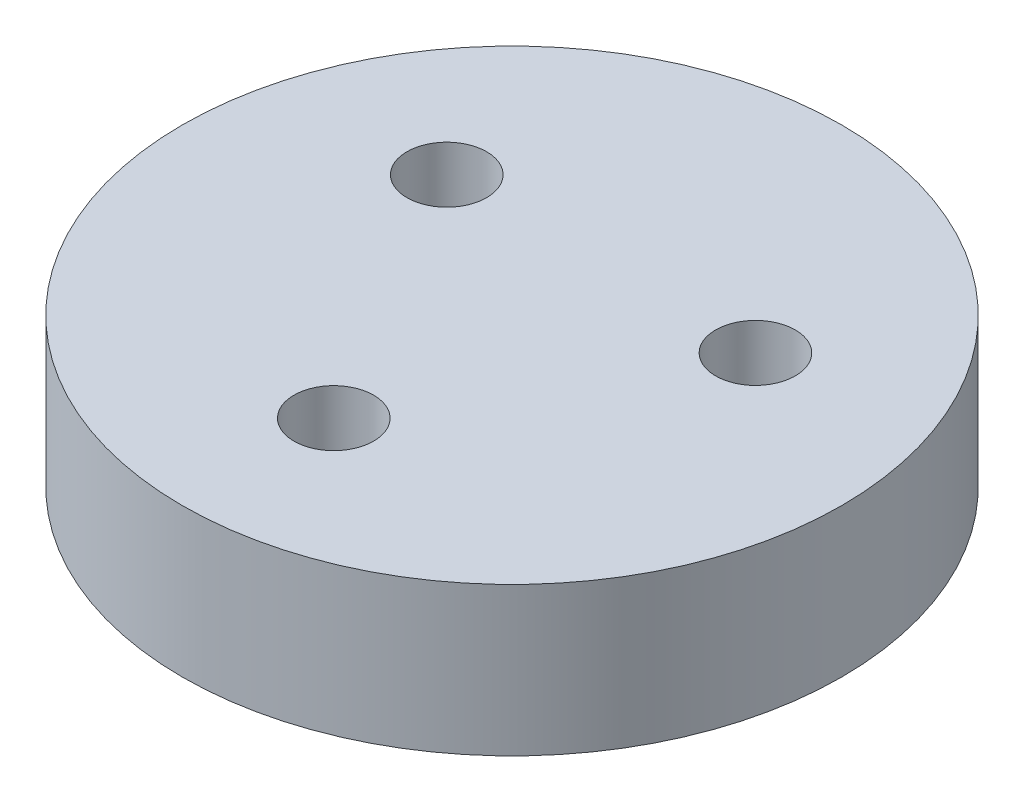
from build123d import *

# Parameters (mm, degrees)
SKETCH4_R           = 33.3
BOSS_EXTRUDE2_DEPTH = 15
SKETCH5_R           = 4.025
CUT_EXTRUDE1_DEPTH  = 50.424487858
SKETCH6_R           = 7.5
BOSS_EXTRUDE3_DEPTH = 10
FILLET1_R           = 2.5


with BuildPart() as part:
    # Sketch4 → Boss-Extrude2 (new body)
    with BuildSketch(Plane(origin=(0, 0, 0), x_dir=(1, 0, 0), z_dir=(0, 1, 0))):
        Circle(SKETCH4_R)
    extrude(amount=BOSS_EXTRUDE2_DEPTH)

    # Sketch5 → Cut-Extrude1 (cut, through all)
    with BuildSketch(Plane.XZ):
        with Locations((0, 18)):
            Circle(SKETCH5_R)
        with Locations((15.588457268, -9)):
            Circle(SKETCH5_R)
        with Locations((-15.588457268, -9)):
            Circle(SKETCH5_R)
    extrude(amount=-CUT_EXTRUDE1_DEPTH, mode=Mode.SUBTRACT)

    # Sketch6 → Boss-Extrude3 (add)
    with BuildSketch(Plane.XZ):
        Circle(SKETCH6_R)
    extrude(amount=BOSS_EXTRUDE3_DEPTH)

    # Fillet1
    fillet1_edges = [part.edges().sort_by_distance(p)[0] for p in [
        (-7.5, 0, 0),
    ]]
    fillet(fillet1_edges, radius=FILLET1_R)


solid = part.part
